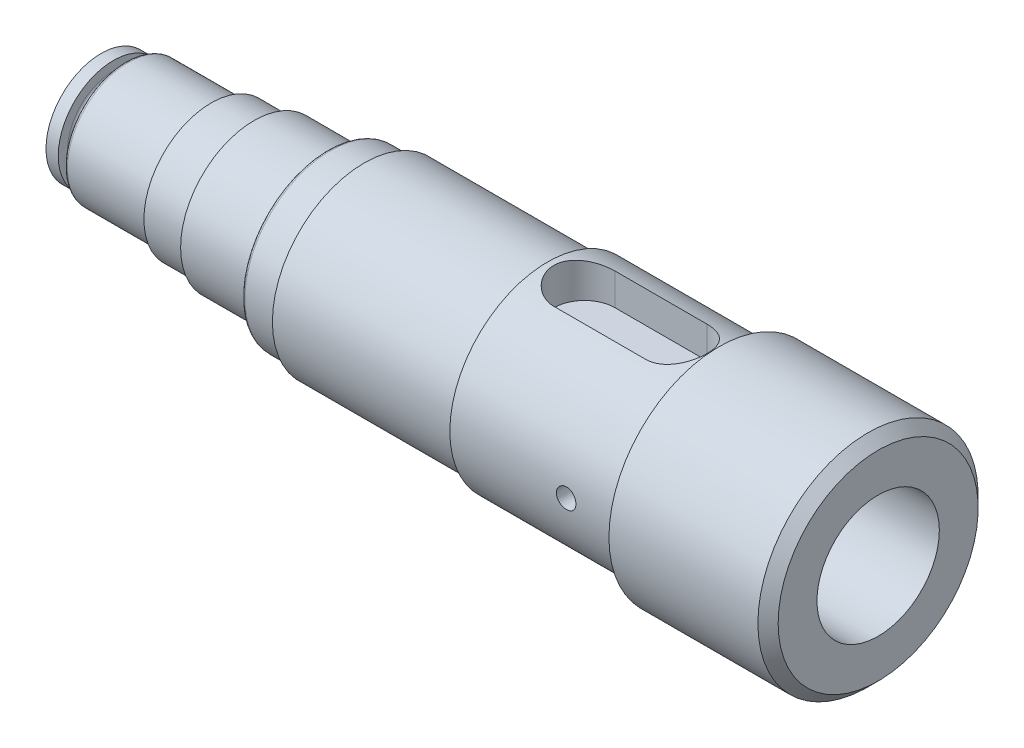
from build123d import *

# Parameters (mm, degrees)
CUT_EXTRUDE1_DEPTH         = 3
SKETCH6_R                  = 2.5
SKETCH6_W                  = 8
SKETCH6_H                  = 5
CUT_EXTRUDE3_DEPTH         = 3
M2X0_4_TAPPED_HOLE1_D      = 1.6
M2X0_4_TAPPED_HOLE1_DEPTH  = 6.2
M2X0_4_TAPPED_HOLE1_TIP    = 0.480688495
F_10_0MM_DOWEL_HOLE1_D     = 10
F_10_0MM_DOWEL_HOLE1_DEPTH = 12
F_10_0MM_DOWEL_HOLE1_TIP   = 3.004303095
FILLET2_R                  = 0.25


# Read off the part's stored shape, not the designer's step: M18x1.5 Machine Threads Stud1
with BuildPart() as part:
    # Sketch1 → Revolve1 (revolve)
    with BuildSketch(Plane.XY, mode=Mode.PRIVATE) as revolve1_sk:
        Polygon((0, 0.614986372), (0, 0), (63.5, 0), (63.5, 11), (53.5, 11), (53.5, 9), (50.5, 9), (50.5, 8), (36.5, 8), (36.5, 7.5), (21.5, 7.5), (21.5, 7), (18.5, 7), (18.5, 6), (12.5, 6), (12.5, 5.5), (9, 5.5), (9, 5), (2, 5), (2, 3.5), (1, 3.5), (1, 4.5), (0, 4.5), align=None)
    revolve(revolve1_sk.sketch.rotate(Axis((0, 0, 0), (1, 0, 0)), 90), axis=Axis((0, 0, 0), (1, 0, 0)))

    # Sketch2 → Cut-Extrude1 (cut)
    with BuildSketch(Plane(origin=(0, 8, 0), x_dir=(1, 0, 0), z_dir=(0, 1, 0))):
        with BuildLine():
            ThreePointArc((39.5, 2.5), (37.732233047, 1.767766953), (37, 0))
            Line((37, 0), (39.5, 0))
            Line((39.5, 0), (39.5, 2.5))
        make_face()
        with BuildLine():
            Line((39.5, 0), (37, 0))
            ThreePointArc((37, 0), (37.732233047, -1.767766953), (39.5, -2.5))
            Line((39.5, -2.5), (39.5, 0))
        make_face()
        with BuildLine():
            Line((39.5, 2.5), (39.5, 0))
            Line((39.5, 0), (42, 0))
            ThreePointArc((42, 0), (41.267766953, 1.767766953), (39.5, 2.5))
        make_face()
        with BuildLine():
            Line((42, 0), (39.5, 0))
            Line((39.5, 0), (39.5, -2.5))
            ThreePointArc((39.5, -2.5), (41.267766953, -1.767766953), (42, 0))
        make_face()
        with BuildLine():
            Line((47, 2.5), (39.5, 2.5))
            ThreePointArc((39.5, 2.5), (41.267766953, 1.767766953), (42, 0))
            Line((42, 0), (44.5, 0))
            ThreePointArc((44.5, 0), (45.232233047, 1.767766953), (47, 2.5))
        make_face()
        with BuildLine():
            ThreePointArc((42, 0), (41.267766953, -1.767766953), (39.5, -2.5))
            Line((39.5, -2.5), (47, -2.5))
            ThreePointArc((47, -2.5), (45.232233047, -1.767766953), (44.5, 0))
            Line((44.5, 0), (42, 0))
        make_face()
        with BuildLine():
            ThreePointArc((49.5, 0), (48.767766953, 1.767766953), (47, 2.5))
            Line((47, 2.5), (47, 0))
            Line((47, 0), (49.5, 0))
        make_face()
        with BuildLine():
            Line((47, 0), (47, 2.5))
            ThreePointArc((47, 2.5), (45.232233047, 1.767766953), (44.5, 0))
            Line((44.5, 0), (47, 0))
        make_face()
        with BuildLine():
            ThreePointArc((44.5, 0), (45.232233047, -1.767766953), (47, -2.5))
            Line((47, -2.5), (47, 0))
            Line((47, 0), (44.5, 0))
        make_face()
        with BuildLine():
            Line((47, 0), (47, -2.5))
            ThreePointArc((47, -2.5), (48.767766953, -1.767766953), (49.5, 0))
            Line((49.5, 0), (47, 0))
        make_face()
    cut_extrude1 = extrude(amount=-CUT_EXTRUDE1_DEPTH, mode=Mode.SUBTRACT)

    # Mirror1: Cut-Extrude1 across plane
    add(cut_extrude1.mirror(Plane.ZX), mode=Mode.SUBTRACT)

    # Sketch6 → Cut-Extrude3 (cut)
    with BuildSketch(Plane.XY.offset(-7.5)):
        with Locations((25, 0)):
            Circle(SKETCH6_R)
        with Locations((33, 0)):
            Circle(SKETCH6_R)
        with Locations((29, 0)):
            Rectangle(SKETCH6_W, SKETCH6_H)
    extrude(amount=CUT_EXTRUDE3_DEPTH, mode=Mode.SUBTRACT)

    # M2x0.4 Tapped Hole1
    with Locations(Plane.XY.offset(8)):
        with Locations((46, 0)):
            Hole(M2X0_4_TAPPED_HOLE1_D / 2, depth=M2X0_4_TAPPED_HOLE1_DEPTH)
            with Locations((0, 0, -(M2X0_4_TAPPED_HOLE1_DEPTH + M2X0_4_TAPPED_HOLE1_TIP / 2))):  # 118° drill point
                Cone(0, M2X0_4_TAPPED_HOLE1_D / 2, M2X0_4_TAPPED_HOLE1_TIP, mode=Mode.SUBTRACT)

    # M18x1.5 Machine Threads Stud1 outline → M18x1.5 Machine Threads Stud1 (revolve, cut)
    with BuildSketch(Plane.YX):
        Polygon((11, 63.5), (8.172, 63.5), (9, 62.672), (9, 53.5), (11, 53.5), align=None)
    revolve(axis=Axis((0, 0, 0), (1, 0, 0)), mode=Mode.SUBTRACT)

    # Ø10.0mm Dowel Hole1
    with Locations(Plane(origin=(63.5, 0, 0), x_dir=(0, 0, -1), z_dir=(1, 0, 0))):
        with Locations((0, 0)):
            Hole(F_10_0MM_DOWEL_HOLE1_D / 2, depth=F_10_0MM_DOWEL_HOLE1_DEPTH)
            with Locations((0, 0, -(F_10_0MM_DOWEL_HOLE1_DEPTH + F_10_0MM_DOWEL_HOLE1_TIP / 2))):  # 118° drill point
                Cone(0, F_10_0MM_DOWEL_HOLE1_D / 2, F_10_0MM_DOWEL_HOLE1_TIP, mode=Mode.SUBTRACT)

    # Fillet2
    fillet2_edges = [part.edges().sort_by_distance(p)[0] for p in [
        (1, 0, -3.5),
        (2, 0, -3.5),
        (2, 0, -5),
        (9, 0, -5),
        (12.5, 0, -5.5),
        (18.5, 0, -6),
        (18.5, 0, -7),
        (21.5, 0, -7),
        (36.5, 0, -7.5),
        (50.5, 0, -8),
    ]]
    fillet(fillet2_edges, radius=FILLET2_R)


solid = part.part
